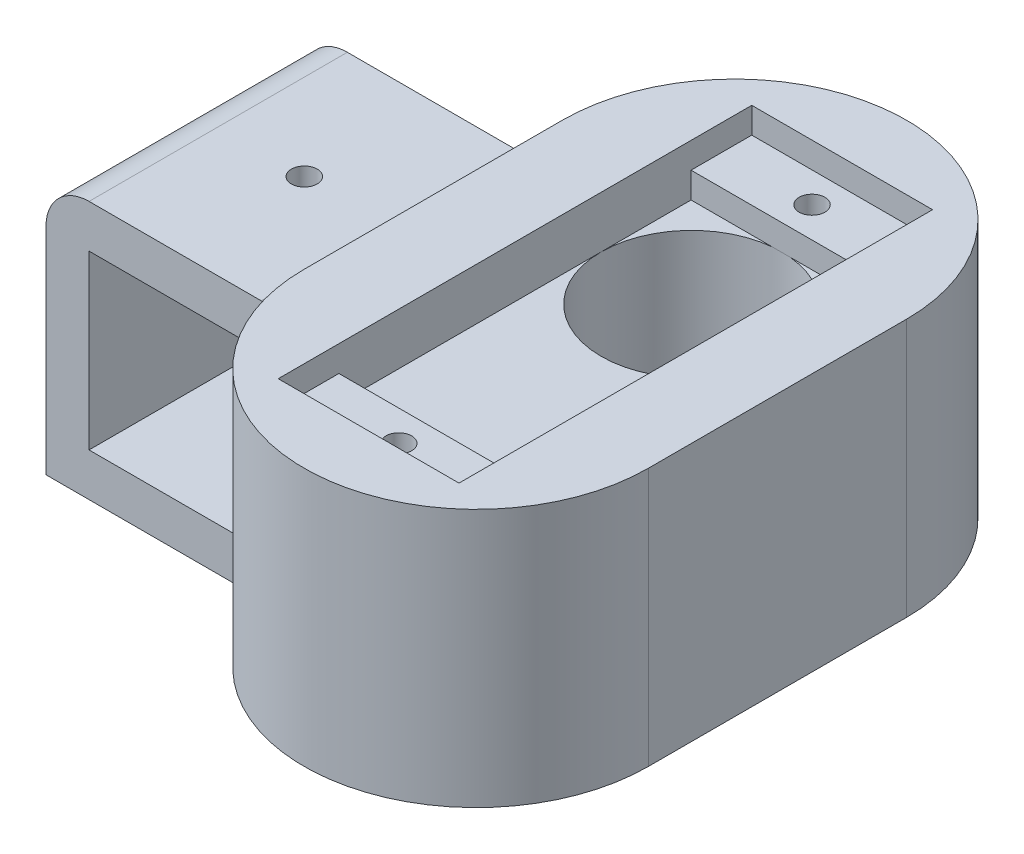
from build123d import *

# Parameters (mm, degrees)
SKETCH1_W           = 30
SKETCH1_H           = 30
SKETCH1_W_2         = 20
SKETCH1_H_2         = 20
BOSS_EXTRUDE2_DEPTH = 30
BOSS_EXTRUDE3_DEPTH = 30
SKETCH6_W           = 21
SKETCH6_H           = 55
CUT_EXTRUDE1_DEPTH  = 3
SKETCH7_R           = 1.5
CUT_EXTRUDE2_DEPTH  = 5
SKETCH8_W           = 21
SKETCH8_H           = 40.9
CUT_EXTRUDE3_DEPTH  = 3
SKETCH9_R           = 10.5
CUT_EXTRUDE4_DEPTH  = 81.056214629
BOSS_EXTRUDE4_START = -10
SKETCH10_R          = 10.5
SKETCH10_R_2        = 4
BOSS_EXTRUDE4_DEPTH = 10
FILLET1_DEPTH       = 30
FILLET1_2_DEPTH     = 30
SKETCH11_R          = 1.5
CUT_EXTRUDE6_DEPTH  = 81.175402093


with BuildPart() as part:
    # Sketch1 → Boss-Extrude2 (new body)
    with BuildSketch(Plane.XY):
        Rectangle(SKETCH1_W, SKETCH1_H)
        Rectangle(SKETCH1_W_2, SKETCH1_H_2, mode=Mode.SUBTRACT)
    extrude(amount=BOSS_EXTRUDE2_DEPTH)

    # Sketch5 → Boss-Extrude3 (add)
    with BuildSketch(Plane(origin=(0, 20.68, 0), x_dir=(1, 0, 0), z_dir=(0, 1, 0))):
        with BuildLine():
            Line((15, -30.030941434), (15, -0.030941434))
            ThreePointArc((15, -0.030941434), (35, 19.969058566), (55, -0.030941434))
            Line((55, -0.030941434), (55, -30.030941434))
            ThreePointArc((55, -30.030941434), (35, -50.030941434), (15, -30.030941434))
        make_face()
    extrude(amount=-BOSS_EXTRUDE3_DEPTH)

    # Sketch6 → Cut-Extrude1 (cut)
    with BuildSketch(Plane(origin=(0, 20.68, 0), x_dir=(1, 0, 0), z_dir=(0, 1, 0))):
        with Locations((35, -15.030941434)):
            Rectangle(SKETCH6_W, SKETCH6_H)
    extrude(amount=-CUT_EXTRUDE1_DEPTH, mode=Mode.SUBTRACT)

    # Sketch7 → Cut-Extrude2 (cut)
    with BuildSketch(Plane(origin=(0, 17.68, 0), x_dir=(1, 0, 0), z_dir=(0, 1, 0))):
        with Locations(Location((35, -39.030941434, 0), (0, 0, 270))):
            Circle(SKETCH7_R)
        with Locations(Location((35, 8.969058566, 0), (0, 0, 270))):
            Circle(SKETCH7_R)
    extrude(amount=-CUT_EXTRUDE2_DEPTH, mode=Mode.SUBTRACT)

    # Sketch8 → Cut-Extrude3 (cut)
    with BuildSketch(Plane(origin=(0, 17.68, 0), x_dir=(1, 0, 0), z_dir=(0, 1, 0))):
        with Locations((35, -15.030941434)):
            Rectangle(SKETCH8_W, SKETCH8_H)
    extrude(amount=-CUT_EXTRUDE3_DEPTH, mode=Mode.SUBTRACT)

    # Sketch9 → Cut-Extrude4 (cut, through all)
    with BuildSketch(Plane(origin=(0, 14.68, 0), x_dir=(1, 0, 0), z_dir=(0, 1, 0))):
        with Locations(Location((35, -5.030941434, 0), (0, 0, 270))):
            Circle(SKETCH9_R)
    extrude(amount=-CUT_EXTRUDE4_DEPTH, mode=Mode.SUBTRACT)

    # Sketch10 → Boss-Extrude4 (add)
    with BuildSketch(Plane.XZ.offset(9.32).offset(BOSS_EXTRUDE4_START)):
        with Locations(Location((35, 5.030941434, 0), (0, 0, 180))):
            Circle(SKETCH10_R)
        with Locations(Location((35, 5.030941434, 0), (0, 0, 270))):
            Circle(SKETCH10_R_2, mode=Mode.SUBTRACT)
    extrude(amount=BOSS_EXTRUDE4_DEPTH)

    # Fillet1: read off the stored shape, not the designer's step
    # Fillet1 outline → Fillet1 (cut)
    with BuildSketch(Plane.XY):
        with BuildLine():
            ThreePointArc((-15, 10), (-13.535533906, 13.535533906), (-10, 15))
            Line((-10, 15), (-15, 15))
            Line((-15, 15), (-15, 10))
        make_face()
    extrude(amount=FILLET1_DEPTH, mode=Mode.SUBTRACT)

    # Fillet1 2 outline → Fillet1 2 (add)
    with BuildSketch(Plane.XY):
        with BuildLine():
            ThreePointArc((15, 20), (13.535533906, 16.464466094), (10, 15))
            Line((10, 15), (15, 15))
            Line((15, 15), (15, 20))
        make_face()
    extrude(amount=FILLET1_2_DEPTH)

    # Sketch11 → Cut-Extrude6 (cut, through all)
    with BuildSketch(Plane(origin=(0, 15, 0), x_dir=(1, 0, 0), z_dir=(0, 1, 0))):
        with Locations(Location((0, -15, 0), (0, 0, 270))):
            Circle(SKETCH11_R)
    extrude(amount=-CUT_EXTRUDE6_DEPTH, mode=Mode.SUBTRACT)


solid = part.part
